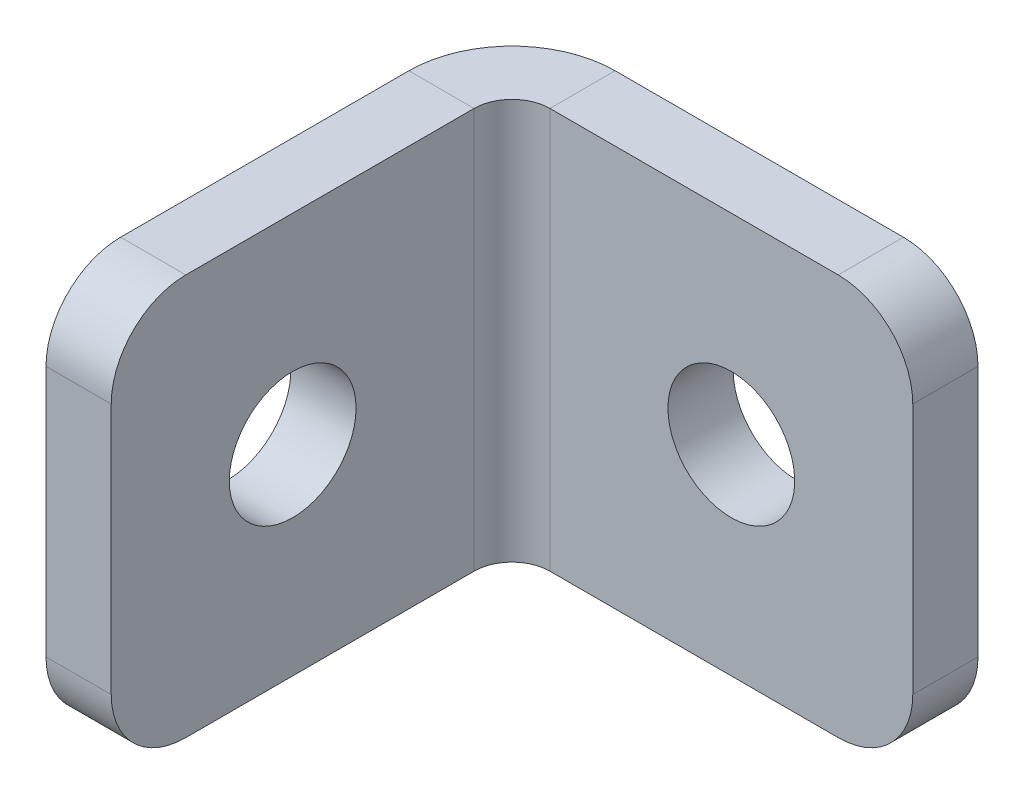
from build123d import *

# Parameters (mm, degrees)
SKETCH1_W                      = 10.75
SKETCH1_H                      = 10.75
BASE_FLANGE1_DEPTH             = 1.75
EDGE_FLANGE1_STRIP_W           = 9.032
EDGE_FLANGE1_STRIP_H           = 1.75
EDGE_FLANGE1_STRIP_CUT_DEPTH   = 10.75
EDGE_FLANGE1_DEPTH             = 10.75
M3_CLEARANCE_HOLE1_D           = 3.4
M3_CLEARANCE_HOLE1_ON_FACE_2_D = 3.4
FILLET1_R                      = 2


# Sheet-metal steps are written as plain solids
with BuildPart() as part:
    # Sketch1 → Base-Flange1 (new body)
    with BuildSketch(Plane.XY):
        with Locations((5.375, 5.375)):
            Rectangle(SKETCH1_W, SKETCH1_H)
    extrude(amount=-BASE_FLANGE1_DEPTH)

    # Edge-Flange1 strip (across the edge) → Edge-Flange1 strip cut (cut)
    with BuildSketch(Plane.XZ.offset(-10.75)):
        with Locations((-3.5, -0.875)):
            Rectangle(EDGE_FLANGE1_STRIP_W, EDGE_FLANGE1_STRIP_H)
    extrude(amount=EDGE_FLANGE1_STRIP_CUT_DEPTH, mode=Mode.SUBTRACT)

    # Edge-Flange1 section (across the edge) → Edge-Flange1 (add)
    with BuildSketch(Plane.XZ.offset(-10.75)):
        with BuildLine():
            Line((-1.75, 1.016), (-1.75, 10.75))
            Line((-1.75, 10.75), (0, 10.75))
            Line((0, 10.75), (0, 1.016))
            ThreePointArc((0, 1.016), (0.29757951, 0.29757951), (1.016, 0))
            Line((1.016, 0), (1.016, -1.75))
            ThreePointArc((1.016, -1.75), (-0.939857357, -0.939857357), (-1.75, 1.016))
        make_face()
    extrude(amount=EDGE_FLANGE1_DEPTH)

    # M3 Clearance Hole1 (through all)
    with Locations(Plane(origin=(5.883, 5.375, -1.75), x_dir=(-1, 0, 0), z_dir=(0, 0, -1))):
        with Locations((0, 0)):
            Hole(M3_CLEARANCE_HOLE1_D / 2)

    # M3 Clearance Hole1 on face 2 (through all)
    with Locations(Plane(origin=(-1.75, 5.375, 5.883), x_dir=(0, 0, -1), z_dir=(-1, 0, 0))):
        with Locations((0, 0)):
            Hole(M3_CLEARANCE_HOLE1_ON_FACE_2_D / 2)

    # Fillet1
    fillet1_edges = [part.edges().sort_by_distance(p)[0] for p in [
        (-0.875, 10.75, 10.75),
        (-0.875, 0, 10.75),
        (10.75, 10.75, -0.875),
        (10.75, 0, -0.875),
    ]]
    fillet(fillet1_edges, radius=FILLET1_R)


solid = part.part
